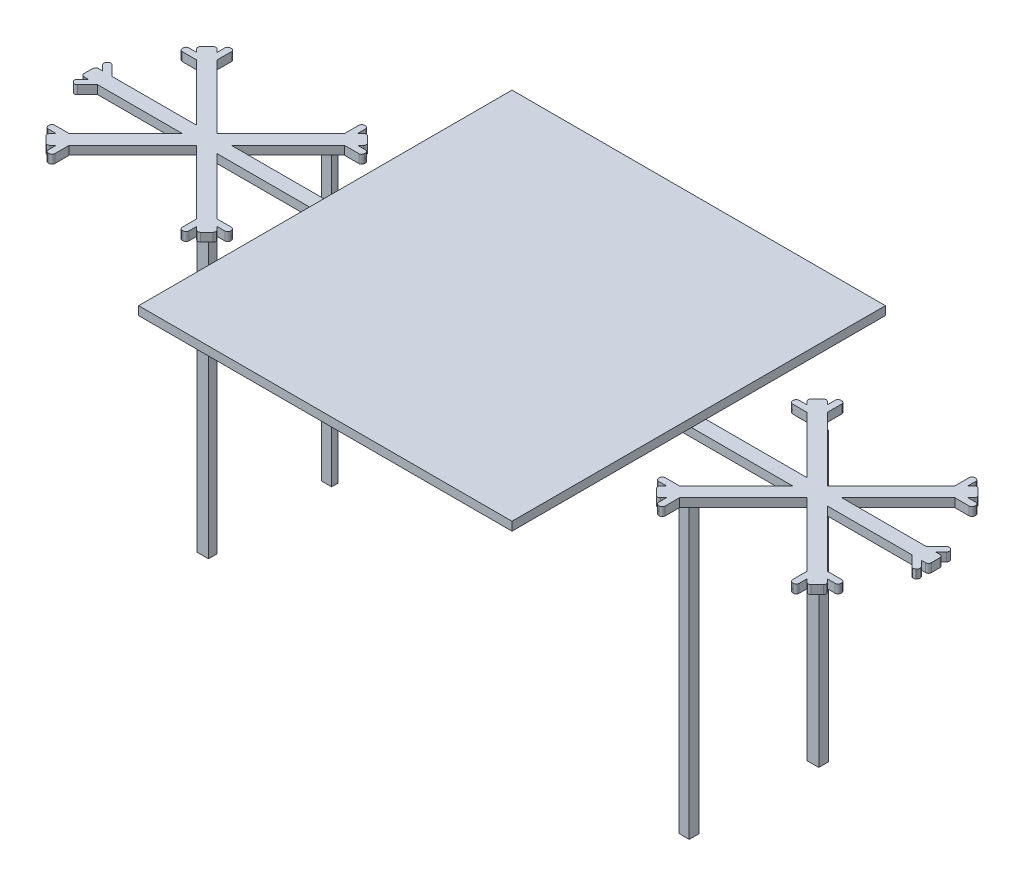
from build123d import *

# Parameters (mm, degrees)
SKETCH1_W           = 130
SKETCH1_H           = 130
BOSS_EXTRUDE1_DEPTH = 3
BOSS_EXTRUDE3_DEPTH = 3
FILLET1_R           = 1
SKETCH3_W           = 3.965686625
SKETCH3_H           = 2.959653683
SKETCH3_W_2         = 3.45962134
SKETCH3_H_2         = 2.230935605
SKETCH3_W_3         = 4.08664758
SKETCH3_H_3         = 3.34080174
SKETCH3_W_4         = 3.481915156
SKETCH3_H_4         = 3.338822753
BOSS_EXTRUDE4_DEPTH = 100


with BuildPart() as part:
    # Sketch1 → Boss-Extrude1 (new body)
    with BuildSketch(Plane(origin=(0, 0, 0), x_dir=(1, 0, 0), z_dir=(0, 1, 0))):
        Rectangle(SKETCH1_W, SKETCH1_H)
    extrude(amount=BOSS_EXTRUDE1_DEPTH)

    # Sketch2 → Boss-Extrude3 (add)
    with BuildSketch(Plane.XZ):
        Polygon((-147.50158677, 2.501585347), (-147.50158677, -2.498414653), (-144.99841323, -2.498414653), (-147.628851167, -5.12885259), (-146.016648418, -6.74105534), (-141.77400773, -2.498414653), (-112.287119253, -2.498414653), (-131.97245322, -22.183748619), (-137.97245322, -22.183748619), (-137.97245322, -24.461573503), (-134.251863451, -24.46315885), (-136.018045056, -26.229340456), (-132.48251115, -29.764874362), (-130.714744197, -27.997107409), (-130.714744197, -31.719282525), (-128.436919314, -31.719282525), (-128.436919314, -25.719282525), (-106.25, -3.532363211), (-84.063080686, -25.719282525), (-84.063080686, -31.719282525), (-81.785255803, -31.719282525), (-81.785255803, -27.997107409), (-80.01748885, -29.764874362), (-76.483540291, -26.230925803), (-78.251307244, -24.46315885), (-74.529132128, -24.46315885), (-74.529132128, -22.185333966), (-80.529132128, -22.185333966), (-100.216051441, -2.498414653), (100.216051441, -2.498414653), (80.529132128, -22.185333966), (74.529132128, -22.185333966), (74.529132128, -24.46315885), (78.251307244, -24.46315885), (76.483540291, -26.230925803), (80.01748885, -29.764874362), (81.785255803, -27.997107409), (81.785255803, -31.719282525), (84.063080686, -31.719282525), (84.063080686, -25.719282525), (106.25, -3.532363211), (128.436919314, -25.719282525), (128.436919314, -31.719282525), (130.714744197, -31.719282525), (130.714744197, -27.997107409), (132.48251115, -29.764874362), (136.018045056, -26.229340456), (134.251863451, -24.46315885), (137.97245322, -24.461573503), (137.97245322, -22.183748619), (131.97245322, -22.183748619), (112.287119253, -2.498414653), (141.77400773, -2.498414653), (146.016648418, -6.74105534), (147.628851167, -5.12885259), (144.99841323, -2.498414653), (147.50158677, -2.498414653), (147.50158677, 2.501585347), (144.99841323, 2.501585347), (147.628851167, 5.132023285), (146.016648418, 6.744226034), (141.77400773, 2.501585347), (112.287119253, 2.501585347), (131.97245322, 22.186919314), (137.97245322, 22.186919314), (137.97245322, 24.464744197), (134.250278103, 24.464744197), (136.018045056, 26.23251115), (132.48251115, 29.768045056), (130.714744197, 28.000278103), (130.714744197, 31.72245322), (128.436919314, 31.72245322), (128.436919314, 25.72245322), (106.25, 3.535533906), (84.063080686, 25.72245322), (84.063080686, 31.72245322), (81.785255803, 31.72245322), (81.785255803, 28.000278103), (80.01748885, 29.768045056), (76.483540291, 26.234096498), (78.251307244, 24.466329545), (74.529132128, 24.466329545), (74.529132128, 22.188504661), (80.529132128, 22.188504661), (100.216051441, 2.501585347), (-100.216051441, 2.501585347), (-80.529132128, 22.188504661), (-74.529132128, 22.188504661), (-74.529132128, 24.466329545), (-78.251307244, 24.466329545), (-76.483540291, 26.234096498), (-80.01748885, 29.768045056), (-81.785255803, 28.000278103), (-81.785255803, 31.72245322), (-84.063080686, 31.72245322), (-84.063080686, 25.72245322), (-106.25, 3.535533906), (-128.436919314, 25.72245322), (-128.436919314, 31.72245322), (-130.714744197, 31.72245322), (-130.714744197, 28.000278103), (-132.48251115, 29.768045056), (-136.018045056, 26.23251115), (-134.250278103, 24.464744197), (-137.97245322, 24.464744197), (-137.97245322, 22.186919314), (-131.97245322, 22.186919314), (-112.287119253, 2.501585347), (-141.77400773, 2.501585347), (-146.016648418, 6.744226034), (-147.628851167, 5.132023285), (-144.99841323, 2.501585347), align=None)
    extrude(amount=BOSS_EXTRUDE3_DEPTH)

    # Fillet1
    fillet1_edges = [part.edges().sort_by_distance(p)[0] for p in [
        (-74.529132128, -1.5, -22.185333966),
        (-74.529132128, -1.5, -24.46315885),
        (-76.483540291, -1.5, -26.230925803),
        (-80.01748885, -1.5, -29.764874362),
        (-81.785255803, -1.5, -31.719282525),
        (-84.063080686, -1.5, -31.719282525),
        (-74.529132128, -1.5, 22.188504661),
        (-74.529132128, -1.5, 24.466329545),
        (-76.483540291, -1.5, 26.234096498),
        (-80.01748885, -1.5, 29.768045056),
        (-81.785255803, -1.5, 31.72245322),
        (-84.063080686, -1.5, 31.72245322),
        (-128.436919314, -1.5, 31.72245322),
        (-130.714744197, -1.5, 31.72245322),
        (-132.48251115, -1.5, 29.768045056),
        (-136.018045056, -1.5, 26.23251115),
        (-137.97245322, -1.5, 22.186919314),
        (-137.97245322, -1.5, 24.464744197),
        (-128.436919314, -1.5, -31.719282525),
        (-130.714744197, -1.5, -31.719282525),
        (-132.48251115, -1.5, -29.764874362),
        (-136.018045056, -1.5, -26.229340456),
        (-137.97245322, -1.5, -24.461573503),
        (-137.97245322, -1.5, -22.183748619),
        (-146.016648418, -1.5, 6.744226034),
        (-147.628851167, -1.5, 5.132023285),
        (-147.50158677, -1.5, 2.501585347),
        (-147.50158677, -1.5, -2.498414653),
        (-147.628851167, -1.5, -5.12885259),
        (-146.016648418, -1.5, -6.74105534),
        (84.063080686, -1.5, -31.719282525),
        (81.785255803, -1.5, -31.719282525),
        (80.01748885, -1.5, -29.764874362),
        (76.483540291, -1.5, -26.230925803),
        (74.529132128, -1.5, -22.185333966),
        (74.529132128, -1.5, -24.46315885),
        (74.529132128, -1.5, 22.188504661),
        (74.529132128, -1.5, 24.466329545),
        (76.483540291, -1.5, 26.234096498),
        (80.01748885, -1.5, 29.768045056),
        (84.063080686, -1.5, 31.72245322),
        (81.785255803, -1.5, 31.72245322),
        (128.436919314, -1.5, 31.72245322),
        (130.714744197, -1.5, 31.72245322),
        (132.48251115, -1.5, 29.768045056),
        (136.018045056, -1.5, 26.23251115),
        (137.97245322, -1.5, 24.464744197),
        (137.97245322, -1.5, 22.186919314),
        (146.016648418, -1.5, 6.744226034),
        (147.628851167, -1.5, 5.132023285),
        (147.50158677, -1.5, 2.501585347),
        (147.50158677, -1.5, -2.498414653),
        (147.628851167, -1.5, -5.12885259),
        (146.016648418, -1.5, -6.74105534),
        (137.97245322, -1.5, -22.183748619),
        (137.97245322, -1.5, -24.461573503),
        (136.018045056, -1.5, -26.229340456),
        (132.48251115, -1.5, -29.764874362),
        (130.714744197, -1.5, -31.719282525),
        (128.436919314, -1.5, -31.719282525),
    ]]
    fillet(fillet1_edges, radius=FILLET1_R)

    # Sketch3 → Boss-Extrude4 (add)
    with BuildSketch(Plane.XZ.offset(3)):
        with Locations((-84.492316523, 21.68799042)):
            Rectangle(SKETCH3_W, SKETCH3_H)
        with Locations((-84.491523849, -21.068220718)):
            Rectangle(SKETCH3_W_2, SKETCH3_H_2)
        with Locations((84.599323341, -21.828867413)):
            Rectangle(SKETCH3_W_3, SKETCH3_H_3)
        with Locations((84.050158455, 22.420317733)):
            Rectangle(SKETCH3_W_4, SKETCH3_H_4)
    extrude(amount=BOSS_EXTRUDE4_DEPTH)


solid = part.part
